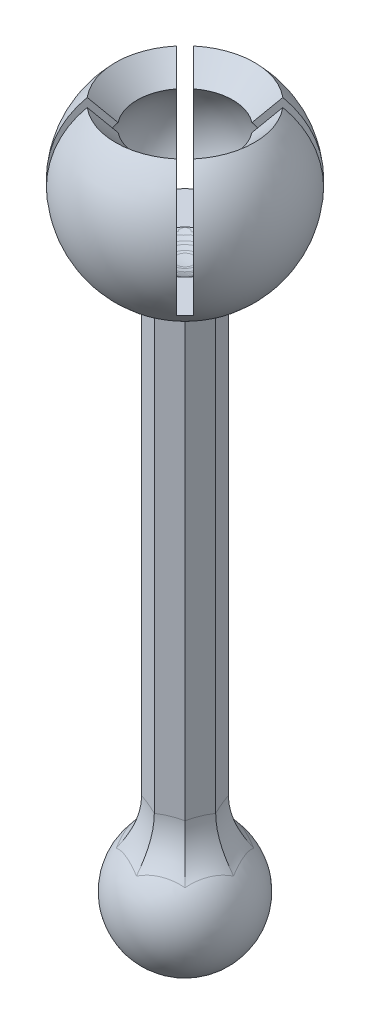
from build123d import *

# Parameters (mm, degrees)
BOSS_EXTRUDE2_DEPTH            = 25
FILLET2_R                      = 5
CUT_EXTRUDE3_REACH             = 58.152
CUT_EXTRUDE3_DIRECTION_2_DEPTH = 4.89898


with BuildPart() as part:
    # Sketch5 → Boss-Extrude2 (new, symmetric)
    with BuildSketch(Plane(origin=(0, 0, 0), x_dir=(1, 0, 0), z_dir=(0, 1, 0))):
        Polygon((2.5, 0), (1.767766953, 1.767766953), (0, 2.5), (-1.767766953, 1.767766953), (-2.5, 0), (-1.767766953, -1.767766953), (0, -2.5), (1.767766953, -1.767766953), align=None)
    extrude(amount=BOSS_EXTRUDE2_DEPTH, both=True)

    # Sketch1 → Revolve1 (revolve)
    with BuildSketch(Plane(origin=(0, -25, 0), x_dir=(1, 0, 0), z_dir=(0, 1, 0))):
        with BuildLine():
            Line((0, 5), (0, -5))
            ThreePointArc((0, -5), (-5, 0), (0, 5))
        make_face()
    revolve(axis=Axis((0, -25, -5), (0, 0, 1)))

    # Sketch4 → Cut-Revolve1 (revolve, cut)
    with BuildSketch(Plane.XY):
        with BuildLine():
            Line((0, 30.5), (0, 19.5))
            ThreePointArc((0, 19.5), (-5.5, 25), (0, 30.5))
        make_face()
    revolve(axis=Axis((0, 30.5, 0), (0, -1, 0)), mode=Mode.SUBTRACT)

    # Fillet2
    # the kernel refuses this fillet: 5 mm, written as the material it adds along each edge
    with BuildSketch(Plane(origin=(0.883883476, -25, 2.133883476), x_dir=(0.9238618205615631, 0.0061921066631474625, -0.3826760958352982), z_dir=(0.005720760609208701, -0.9999808287237671, -0.002369616631424014))) as fillet2_piece_1_section:
        with BuildLine():
            CenterArc((6.824097229, 5), FILLET2_R, 226.967764514, 43.032235486)
            Line((6.824097229, 0), (6.824097229, -0.1))
            Line((6.824097229, -0.1), (4.434556495, -0.1))
            Line((4.434556495, -0.1), (4.345865365, -0.046193977))
            ThreePointArc((4.345865365, -0.046193977), (3.900924494, 0.655564748), (3.343807642, 1.272053596))
            Line((3.343807642, 1.272053596), (3.412048615, 1.345150584))
        make_face()
    fillet2_piece_1 = revolve(axis=Axis((0.883883476, -25, 2.133883476), (0.38268343236508984, 0, 0.9238795325112867)), revolution_arc=179.290432309, mode=Mode.PRIVATE)
    fillet2_piece_1 = split(fillet2_piece_1, bisect_by=Plane(origin=(1.508883476, -25, 2.392766953), z_dir=(-0.9238795325112867, 0, -0.38268343236508995)), keep=Keep.TOP, mode=Mode.PRIVATE)
    fillet2_piece_1 = split(fillet2_piece_1, bisect_by=Plane(origin=(0.625, -25, 2.758883476), z_dir=(0.38268343236509017, 0, -0.9238795325112866)), keep=Keep.TOP, mode=Mode.PRIVATE)
    add(fillet2_piece_1)
    with BuildSketch(Plane(origin=(0.883883476, -25, 2.133883476), x_dir=(0.9238618205615631, 0.0061921066631474625, -0.3826760958352982), z_dir=(0.005720760609208701, -0.9999808287237671, -0.002369616631424014))) as fillet2_piece_2_section:
        with BuildLine():
            CenterArc((6.824097229, 5), FILLET2_R, 226.967764514, 43.032235486)
            Line((6.824097229, 0), (6.824097229, -0.1))
            Line((6.824097229, -0.1), (4.434556495, -0.1))
            Line((4.434556495, -0.1), (4.345865365, -0.046193977))
            ThreePointArc((4.345865365, -0.046193977), (3.900924494, 0.655564748), (3.343807642, 1.272053596))
            Line((3.343807642, 1.272053596), (3.412048615, 1.345150584))
        make_face()
    fillet2_piece_2 = revolve(axis=Axis((0.883883476, -25, 2.133883476), (0.38268343236508984, 0, 0.9238795325112867)), revolution_arc=179.290432309, mode=Mode.PRIVATE)
    fillet2_piece_2 = split(fillet2_piece_2, bisect_by=Plane(origin=(1.508883476, -25, 2.392766953), z_dir=(0.9238795325112867, 0, 0.38268343236508995)), keep=Keep.TOP, mode=Mode.PRIVATE)
    fillet2_piece_2 = split(fillet2_piece_2, bisect_by=Plane(origin=(0.625, -25, 2.758883476), z_dir=(-0.38268343236509017, 0, 0.9238795325112866)), keep=Keep.TOP, mode=Mode.PRIVATE)
    add(fillet2_piece_2)
    with BuildSketch(Plane(origin=(2.133883476, -25, 0.883883476), x_dir=(0.3826760958352924, 0.006192106665672666, -0.9238618205615488), z_dir=(0.002369616632390368, -0.9999808287237517, -0.0057207606115416846))) as fillet2_piece_3_section:
        with BuildLine():
            CenterArc((6.824097229, 5), FILLET2_R, 226.967764514, 43.032235486)
            Line((6.824097229, 0), (6.824097229, -0.1))
            Line((6.824097229, -0.1), (4.434556495, -0.1))
            Line((4.434556495, -0.1), (4.345865365, -0.046193977))
            ThreePointArc((4.345865365, -0.046193977), (3.900924494, 0.655564748), (3.343807642, 1.272053596))
            Line((3.343807642, 1.272053596), (3.412048615, 1.345150584))
        make_face()
    fillet2_piece_3 = revolve(axis=Axis((2.133883476, -25, 0.883883476), (0.9238795325112867, 0, 0.38268343236508995)), revolution_arc=179.290432309, mode=Mode.PRIVATE)
    fillet2_piece_3 = split(fillet2_piece_3, bisect_by=Plane(origin=(2.758883476, -25, 0.625), z_dir=(-0.9238795325112868, 0, 0.3826834323650896)), keep=Keep.TOP, mode=Mode.PRIVATE)
    fillet2_piece_3 = split(fillet2_piece_3, bisect_by=Plane(origin=(2.392766953, -25, 1.508883476), z_dir=(-0.3826834323650898, 0, -0.9238795325112866)), keep=Keep.TOP, mode=Mode.PRIVATE)
    add(fillet2_piece_3)
    with BuildSketch(Plane(origin=(2.133883476, -25, 0.883883476), x_dir=(0.3826760958352924, 0.006192106665672666, -0.9238618205615488), z_dir=(0.002369616632390368, -0.9999808287237517, -0.0057207606115416846))) as fillet2_piece_4_section:
        with BuildLine():
            CenterArc((6.824097229, 5), FILLET2_R, 226.967764514, 43.032235486)
            Line((6.824097229, 0), (6.824097229, -0.1))
            Line((6.824097229, -0.1), (4.434556495, -0.1))
            Line((4.434556495, -0.1), (4.345865365, -0.046193977))
            ThreePointArc((4.345865365, -0.046193977), (3.900924494, 0.655564748), (3.343807642, 1.272053596))
            Line((3.343807642, 1.272053596), (3.412048615, 1.345150584))
        make_face()
    fillet2_piece_4 = revolve(axis=Axis((2.133883476, -25, 0.883883476), (0.9238795325112867, 0, 0.38268343236508995)), revolution_arc=179.290432309, mode=Mode.PRIVATE)
    fillet2_piece_4 = split(fillet2_piece_4, bisect_by=Plane(origin=(2.758883476, -25, 0.625), z_dir=(0.9238795325112868, 0, -0.3826834323650896)), keep=Keep.TOP, mode=Mode.PRIVATE)
    fillet2_piece_4 = split(fillet2_piece_4, bisect_by=Plane(origin=(2.392766953, -25, 1.508883476), z_dir=(0.3826834323650898, 0, 0.9238795325112866)), keep=Keep.TOP, mode=Mode.PRIVATE)
    add(fillet2_piece_4)
    with BuildSketch(Plane(origin=(2.133883476, -25, -0.883883476), x_dir=(-0.38267609583529205, 0.006192106665675869, -0.9238618205615488), z_dir=(-0.002369616632391592, -0.9999808287237515, -0.005720760611544645))) as fillet2_piece_5_section:
        with BuildLine():
            CenterArc((6.824097229, 5), FILLET2_R, 226.967764514, 43.032235486)
            Line((3.412048615, 1.345150584), (3.343807642, 1.272053596))
            ThreePointArc((3.343807642, 1.272053596), (3.900924494, 0.655564748), (4.345865365, -0.046193977))
            Line((4.345865365, -0.046193977), (4.434556495, -0.1))
            Line((4.434556495, -0.1), (6.824097229, -0.1))
            Line((6.824097229, -0.1), (6.824097229, 0))
        make_face()
    fillet2_piece_5 = revolve(axis=Axis((2.133883476, -25, -0.883883476), (0.9238795325112868, 0, -0.3826834323650896)), revolution_arc=179.290432309, mode=Mode.PRIVATE)
    fillet2_piece_5 = split(fillet2_piece_5, bisect_by=Plane(origin=(2.392766953, -25, -1.508883476), z_dir=(0.3826834323650899, 0, -0.9238795325112867)), keep=Keep.TOP, mode=Mode.PRIVATE)
    fillet2_piece_5 = split(fillet2_piece_5, bisect_by=Plane(origin=(2.758883476, -25, -0.625), z_dir=(0.9238795325112867, 0, 0.38268343236508995)), keep=Keep.TOP, mode=Mode.PRIVATE)
    add(fillet2_piece_5)
    with BuildSketch(Plane(origin=(2.133883476, -25, -0.883883476), x_dir=(-0.38267609583529205, 0.006192106665675869, -0.9238618205615488), z_dir=(-0.002369616632391592, -0.9999808287237515, -0.005720760611544645))) as fillet2_piece_6_section:
        with BuildLine():
            CenterArc((6.824097229, 5), FILLET2_R, 226.967764514, 43.032235486)
            Line((3.412048615, 1.345150584), (3.343807642, 1.272053596))
            ThreePointArc((3.343807642, 1.272053596), (3.900924494, 0.655564748), (4.345865365, -0.046193977))
            Line((4.345865365, -0.046193977), (4.434556495, -0.1))
            Line((4.434556495, -0.1), (6.824097229, -0.1))
            Line((6.824097229, -0.1), (6.824097229, 0))
        make_face()
    fillet2_piece_6 = revolve(axis=Axis((2.133883476, -25, -0.883883476), (0.9238795325112868, 0, -0.3826834323650896)), revolution_arc=179.290432309, mode=Mode.PRIVATE)
    fillet2_piece_6 = split(fillet2_piece_6, bisect_by=Plane(origin=(2.392766953, -25, -1.508883476), z_dir=(-0.3826834323650899, 0, 0.9238795325112867)), keep=Keep.TOP, mode=Mode.PRIVATE)
    fillet2_piece_6 = split(fillet2_piece_6, bisect_by=Plane(origin=(2.758883476, -25, -0.625), z_dir=(-0.9238795325112867, 0, -0.38268343236508995)), keep=Keep.TOP, mode=Mode.PRIVATE)
    add(fillet2_piece_6)
    with BuildSketch(Plane(origin=(0.883883476, -25, -2.133883476), x_dir=(-0.9238618205615631, 0.006192106663146662, -0.3826760958352983), z_dir=(-0.005720760609207962, -0.9999808287237673, -0.002369616631423708))) as fillet2_piece_7_section:
        with BuildLine():
            CenterArc((6.824097229, 5), FILLET2_R, 226.967764514, 43.032235486)
            Line((3.412048615, 1.345150584), (3.343807642, 1.272053596))
            ThreePointArc((3.343807642, 1.272053596), (3.900924494, 0.655564748), (4.345865365, -0.046193977))
            Line((4.345865365, -0.046193977), (4.434556495, -0.1))
            Line((4.434556495, -0.1), (6.824097229, -0.1))
            Line((6.824097229, -0.1), (6.824097229, 0))
        make_face()
    fillet2_piece_7 = revolve(axis=Axis((0.883883476, -25, -2.133883476), (0.3826834323650899, 0, -0.9238795325112867)), revolution_arc=179.290432309, mode=Mode.PRIVATE)
    fillet2_piece_7 = split(fillet2_piece_7, bisect_by=Plane(origin=(1.508883476, -25, -2.392766953), z_dir=(0.9238795325112868, 0, -0.3826834323650896)), keep=Keep.TOP, mode=Mode.PRIVATE)
    fillet2_piece_7 = split(fillet2_piece_7, bisect_by=Plane(origin=(0.625, -25, -2.758883476), z_dir=(-0.3826834323650895, 0, -0.9238795325112868)), keep=Keep.TOP, mode=Mode.PRIVATE)
    add(fillet2_piece_7)
    with BuildSketch(Plane(origin=(0.883883476, -25, -2.133883476), x_dir=(-0.9238618205615631, 0.006192106663146662, -0.3826760958352983), z_dir=(-0.005720760609207962, -0.9999808287237673, -0.002369616631423708))) as fillet2_piece_8_section:
        with BuildLine():
            CenterArc((6.824097229, 5), FILLET2_R, 226.967764514, 43.032235486)
            Line((3.412048615, 1.345150584), (3.343807642, 1.272053596))
            ThreePointArc((3.343807642, 1.272053596), (3.900924494, 0.655564748), (4.345865365, -0.046193977))
            Line((4.345865365, -0.046193977), (4.434556495, -0.1))
            Line((4.434556495, -0.1), (6.824097229, -0.1))
            Line((6.824097229, -0.1), (6.824097229, 0))
        make_face()
    fillet2_piece_8 = revolve(axis=Axis((0.883883476, -25, -2.133883476), (0.3826834323650899, 0, -0.9238795325112867)), revolution_arc=179.290432309, mode=Mode.PRIVATE)
    fillet2_piece_8 = split(fillet2_piece_8, bisect_by=Plane(origin=(1.508883476, -25, -2.392766953), z_dir=(-0.9238795325112868, 0, 0.3826834323650896)), keep=Keep.TOP, mode=Mode.PRIVATE)
    fillet2_piece_8 = split(fillet2_piece_8, bisect_by=Plane(origin=(0.625, -25, -2.758883476), z_dir=(0.3826834323650895, 0, 0.9238795325112868)), keep=Keep.TOP, mode=Mode.PRIVATE)
    add(fillet2_piece_8)
    with BuildSketch(Plane(origin=(-0.883883476, -25, -2.133883476), x_dir=(-0.9238618205615633, 0.006192106663145061, 0.382676095835298), z_dir=(-0.005720760609206483, -0.9999808287237673, 0.002369616631423093))) as fillet2_piece_9_section:
        with BuildLine():
            CenterArc((6.824097229, 5), FILLET2_R, 226.967764514, 43.032235486)
            Line((6.824097229, 0), (6.824097229, -0.1))
            Line((6.824097229, -0.1), (4.434556495, -0.1))
            Line((4.434556495, -0.1), (4.345865365, -0.046193977))
            ThreePointArc((4.345865365, -0.046193977), (3.900924494, 0.655564748), (3.343807642, 1.272053596))
            Line((3.343807642, 1.272053596), (3.412048615, 1.345150584))
        make_face()
    fillet2_piece_9 = revolve(axis=Axis((-0.883883476, -25, -2.133883476), (-0.3826834323650895, 0, -0.9238795325112868)), revolution_arc=179.290432309, mode=Mode.PRIVATE)
    fillet2_piece_9 = split(fillet2_piece_9, bisect_by=Plane(origin=(-0.625, -25, -2.758883476), z_dir=(-0.3826834323650899, 0, 0.9238795325112867)), keep=Keep.TOP, mode=Mode.PRIVATE)
    fillet2_piece_9 = split(fillet2_piece_9, bisect_by=Plane(origin=(-1.508883476, -25, -2.392766953), z_dir=(0.9238795325112867, 0, 0.38268343236508995)), keep=Keep.TOP, mode=Mode.PRIVATE)
    add(fillet2_piece_9)
    with BuildSketch(Plane(origin=(-0.883883476, -25, -2.133883476), x_dir=(-0.9238618205615633, 0.006192106663145061, 0.382676095835298), z_dir=(-0.005720760609206483, -0.9999808287237673, 0.002369616631423093))) as fillet2_piece_10_section:
        with BuildLine():
            CenterArc((6.824097229, 5), FILLET2_R, 226.967764514, 43.032235486)
            Line((6.824097229, 0), (6.824097229, -0.1))
            Line((6.824097229, -0.1), (4.434556495, -0.1))
            Line((4.434556495, -0.1), (4.345865365, -0.046193977))
            ThreePointArc((4.345865365, -0.046193977), (3.900924494, 0.655564748), (3.343807642, 1.272053596))
            Line((3.343807642, 1.272053596), (3.412048615, 1.345150584))
        make_face()
    fillet2_piece_10 = revolve(axis=Axis((-0.883883476, -25, -2.133883476), (-0.3826834323650895, 0, -0.9238795325112868)), revolution_arc=179.290432309, mode=Mode.PRIVATE)
    fillet2_piece_10 = split(fillet2_piece_10, bisect_by=Plane(origin=(-0.625, -25, -2.758883476), z_dir=(0.3826834323650899, 0, -0.9238795325112867)), keep=Keep.TOP, mode=Mode.PRIVATE)
    fillet2_piece_10 = split(fillet2_piece_10, bisect_by=Plane(origin=(-1.508883476, -25, -2.392766953), z_dir=(-0.9238795325112867, 0, -0.38268343236508995)), keep=Keep.TOP, mode=Mode.PRIVATE)
    add(fillet2_piece_10)
    with BuildSketch(Plane(origin=(-2.133883476, -25, -0.883883476), x_dir=(-0.3826760958352924, 0.006192106665672666, 0.9238618205615488), z_dir=(-0.002369616632390368, -0.9999808287237517, 0.0057207606115416846))) as fillet2_piece_11_section:
        with BuildLine():
            CenterArc((6.824097229, 5), FILLET2_R, 226.967764514, 43.032235486)
            Line((6.824097229, 0), (6.824097229, -0.1))
            Line((6.824097229, -0.1), (4.434556495, -0.1))
            Line((4.434556495, -0.1), (4.345865365, -0.046193977))
            ThreePointArc((4.345865365, -0.046193977), (3.900924494, 0.655564748), (3.343807642, 1.272053596))
            Line((3.343807642, 1.272053596), (3.412048615, 1.345150584))
        make_face()
    fillet2_piece_11 = revolve(axis=Axis((-2.133883476, -25, -0.883883476), (-0.9238795325112867, 0, -0.38268343236508995)), revolution_arc=179.290432309, mode=Mode.PRIVATE)
    fillet2_piece_11 = split(fillet2_piece_11, bisect_by=Plane(origin=(-2.392766953, -25, -1.508883476), z_dir=(0.3826834323650895, 0, 0.9238795325112868)), keep=Keep.TOP, mode=Mode.PRIVATE)
    fillet2_piece_11 = split(fillet2_piece_11, bisect_by=Plane(origin=(-2.758883476, -25, -0.625), z_dir=(0.9238795325112867, 0, -0.3826834323650897)), keep=Keep.TOP, mode=Mode.PRIVATE)
    add(fillet2_piece_11)
    with BuildSketch(Plane(origin=(-2.133883476, -25, -0.883883476), x_dir=(-0.3826760958352924, 0.006192106665672666, 0.9238618205615488), z_dir=(-0.002369616632390368, -0.9999808287237517, 0.0057207606115416846))) as fillet2_piece_12_section:
        with BuildLine():
            CenterArc((6.824097229, 5), FILLET2_R, 226.967764514, 43.032235486)
            Line((6.824097229, 0), (6.824097229, -0.1))
            Line((6.824097229, -0.1), (4.434556495, -0.1))
            Line((4.434556495, -0.1), (4.345865365, -0.046193977))
            ThreePointArc((4.345865365, -0.046193977), (3.900924494, 0.655564748), (3.343807642, 1.272053596))
            Line((3.343807642, 1.272053596), (3.412048615, 1.345150584))
        make_face()
    fillet2_piece_12 = revolve(axis=Axis((-2.133883476, -25, -0.883883476), (-0.9238795325112867, 0, -0.38268343236508995)), revolution_arc=179.290432309, mode=Mode.PRIVATE)
    fillet2_piece_12 = split(fillet2_piece_12, bisect_by=Plane(origin=(-2.392766953, -25, -1.508883476), z_dir=(-0.3826834323650895, 0, -0.9238795325112868)), keep=Keep.TOP, mode=Mode.PRIVATE)
    fillet2_piece_12 = split(fillet2_piece_12, bisect_by=Plane(origin=(-2.758883476, -25, -0.625), z_dir=(-0.9238795325112867, 0, 0.3826834323650897)), keep=Keep.TOP, mode=Mode.PRIVATE)
    add(fillet2_piece_12)
    with BuildSketch(Plane(origin=(-2.133883476, -25, 0.883883476), x_dir=(0.38267609583529216, 0.006192106665672666, 0.9238618205615488), z_dir=(0.002369616632390367, -0.9999808287237516, 0.0057207606115416846))) as fillet2_piece_13_section:
        with BuildLine():
            CenterArc((6.824097229, 5), FILLET2_R, 226.967764514, 43.032235486)
            Line((6.824097229, 0), (6.824097229, -0.1))
            Line((6.824097229, -0.1), (4.434556495, -0.1))
            Line((4.434556495, -0.1), (4.345865365, -0.046193977))
            ThreePointArc((4.345865365, -0.046193977), (3.900924494, 0.655564748), (3.343807642, 1.272053596))
            Line((3.343807642, 1.272053596), (3.412048615, 1.345150584))
        make_face()
    fillet2_piece_13 = revolve(axis=Axis((-2.133883476, -25, 0.883883476), (-0.9238795325112867, 0, 0.3826834323650897)), revolution_arc=179.290432309, mode=Mode.PRIVATE)
    fillet2_piece_13 = split(fillet2_piece_13, bisect_by=Plane(origin=(-2.758883476, -25, 0.625), z_dir=(0.9238795325112867, 0, 0.38268343236508995)), keep=Keep.TOP, mode=Mode.PRIVATE)
    fillet2_piece_13 = split(fillet2_piece_13, bisect_by=Plane(origin=(-2.392766953, -25, 1.508883476), z_dir=(0.38268343236509017, 0, -0.9238795325112866)), keep=Keep.TOP, mode=Mode.PRIVATE)
    add(fillet2_piece_13)
    with BuildSketch(Plane(origin=(-2.133883476, -25, 0.883883476), x_dir=(0.38267609583529216, 0.006192106665672666, 0.9238618205615488), z_dir=(0.002369616632390367, -0.9999808287237516, 0.0057207606115416846))) as fillet2_piece_14_section:
        with BuildLine():
            CenterArc((6.824097229, 5), FILLET2_R, 226.967764514, 43.032235486)
            Line((6.824097229, 0), (6.824097229, -0.1))
            Line((6.824097229, -0.1), (4.434556495, -0.1))
            Line((4.434556495, -0.1), (4.345865365, -0.046193977))
            ThreePointArc((4.345865365, -0.046193977), (3.900924494, 0.655564748), (3.343807642, 1.272053596))
            Line((3.343807642, 1.272053596), (3.412048615, 1.345150584))
        make_face()
    fillet2_piece_14 = revolve(axis=Axis((-2.133883476, -25, 0.883883476), (-0.9238795325112867, 0, 0.3826834323650897)), revolution_arc=179.290432309, mode=Mode.PRIVATE)
    fillet2_piece_14 = split(fillet2_piece_14, bisect_by=Plane(origin=(-2.758883476, -25, 0.625), z_dir=(-0.9238795325112867, 0, -0.38268343236508995)), keep=Keep.TOP, mode=Mode.PRIVATE)
    fillet2_piece_14 = split(fillet2_piece_14, bisect_by=Plane(origin=(-2.392766953, -25, 1.508883476), z_dir=(-0.38268343236509017, 0, 0.9238795325112866)), keep=Keep.TOP, mode=Mode.PRIVATE)
    add(fillet2_piece_14)
    with BuildSketch(Plane(origin=(-0.883883476, -25, 2.133883476), x_dir=(0.923861820561563, 0.006192106663149065, 0.3826760958352986), z_dir=(0.0057207606092101815, -0.9999808287237673, 0.0023696166314246293))) as fillet2_piece_15_section:
        with BuildLine():
            CenterArc((6.824097229, 5), FILLET2_R, 226.967764514, 43.032235486)
            Line((6.824097229, 0), (6.824097229, -0.1))
            Line((6.824097229, -0.1), (4.434556495, -0.1))
            Line((4.434556495, -0.1), (4.345865365, -0.046193977))
            ThreePointArc((4.345865365, -0.046193977), (3.900924494, 0.655564748), (3.343807642, 1.272053596))
            Line((3.343807642, 1.272053596), (3.412048615, 1.345150584))
        make_face()
    fillet2_piece_15 = revolve(axis=Axis((-0.883883476, -25, 2.133883476), (-0.38268343236509017, 0, 0.9238795325112866)), revolution_arc=179.290432309, mode=Mode.PRIVATE)
    fillet2_piece_15 = split(fillet2_piece_15, bisect_by=Plane(origin=(-0.625, -25, 2.758883476), z_dir=(-0.3826834323650898, 0, -0.9238795325112866)), keep=Keep.TOP, mode=Mode.PRIVATE)
    fillet2_piece_15 = split(fillet2_piece_15, bisect_by=Plane(origin=(-1.508883476, -25, 2.392766953), z_dir=(0.9238795325112867, 0, -0.3826834323650897)), keep=Keep.TOP, mode=Mode.PRIVATE)
    add(fillet2_piece_15)
    with BuildSketch(Plane(origin=(-0.883883476, -25, 2.133883476), x_dir=(0.923861820561563, 0.006192106663149065, 0.3826760958352986), z_dir=(0.0057207606092101815, -0.9999808287237673, 0.0023696166314246293))) as fillet2_piece_16_section:
        with BuildLine():
            CenterArc((6.824097229, 5), FILLET2_R, 226.967764514, 43.032235486)
            Line((6.824097229, 0), (6.824097229, -0.1))
            Line((6.824097229, -0.1), (4.434556495, -0.1))
            Line((4.434556495, -0.1), (4.345865365, -0.046193977))
            ThreePointArc((4.345865365, -0.046193977), (3.900924494, 0.655564748), (3.343807642, 1.272053596))
            Line((3.343807642, 1.272053596), (3.412048615, 1.345150584))
        make_face()
    fillet2_piece_16 = revolve(axis=Axis((-0.883883476, -25, 2.133883476), (-0.38268343236509017, 0, 0.9238795325112866)), revolution_arc=179.290432309, mode=Mode.PRIVATE)
    fillet2_piece_16 = split(fillet2_piece_16, bisect_by=Plane(origin=(-0.625, -25, 2.758883476), z_dir=(0.3826834323650898, 0, 0.9238795325112866)), keep=Keep.TOP, mode=Mode.PRIVATE)
    fillet2_piece_16 = split(fillet2_piece_16, bisect_by=Plane(origin=(-1.508883476, -25, 2.392766953), z_dir=(-0.9238795325112867, 0, 0.3826834323650897)), keep=Keep.TOP, mode=Mode.PRIVATE)
    add(fillet2_piece_16)
    with BuildSketch(Plane(origin=(2.133883476, -25, 0.883883476), x_dir=(0.3826760958352924, 0.006192106665672666, -0.9238618205615488), z_dir=(0.002369616632390368, -0.9999808287237517, -0.0057207606115416846))) as fillet2_piece_17a_section:
        with BuildLine():
            CenterArc((6.824097229, 5), FILLET2_R, 226.967764514, 43.032235486)
            Line((6.824097229, 0), (6.824097229, -0.1))
            Line((6.824097229, -0.1), (4.434556495, -0.1))
            Line((4.434556495, -0.1), (4.345865365, -0.046193977))
            ThreePointArc((4.345865365, -0.046193977), (3.900924494, 0.655564748), (3.343807642, 1.272053596))
            Line((3.343807642, 1.272053596), (3.412048615, 1.345150584))
        make_face()
    fillet2_piece_17a = revolve(axis=Axis((2.133883476, -25, 0.883883476), (0.9238795325112867, 0, 0.38268343236508995)), revolution_arc=179.290432309, mode=Mode.PRIVATE)
    fillet2_piece_17a = split(fillet2_piece_17a, bisect_by=Plane(origin=(2.758883476, -25, 0.625), z_dir=(-0.9238795325112868, 0, 0.3826834323650896)), keep=Keep.TOP, mode=Mode.PRIVATE)
    fillet2_piece_17a = split(fillet2_piece_17a, bisect_by=Plane(origin=(2.392766953, -25, 1.508883476), z_dir=(0.3826834323650898, 0, 0.9238795325112866)), keep=Keep.TOP, mode=Mode.PRIVATE)
    with BuildSketch(Plane(origin=(0.883883476, -25, 2.133883476), x_dir=(0.9238618205615631, 0.0061921066631474625, -0.3826760958352982), z_dir=(0.005720760609208701, -0.9999808287237671, -0.002369616631424014))) as fillet2_piece_17b_section:
        with BuildLine():
            CenterArc((6.824097229, 5), FILLET2_R, 226.967764514, 43.032235486)
            Line((6.824097229, 0), (6.824097229, -0.1))
            Line((6.824097229, -0.1), (4.434556495, -0.1))
            Line((4.434556495, -0.1), (4.345865365, -0.046193977))
            ThreePointArc((4.345865365, -0.046193977), (3.900924494, 0.655564748), (3.343807642, 1.272053596))
            Line((3.343807642, 1.272053596), (3.412048615, 1.345150584))
        make_face()
    fillet2_piece_17b = revolve(axis=Axis((0.883883476, -25, 2.133883476), (0.38268343236508984, 0, 0.9238795325112867)), revolution_arc=179.290432309, mode=Mode.PRIVATE)
    fillet2_piece_17b = split(fillet2_piece_17b, bisect_by=Plane(origin=(1.508883476, -25, 2.392766953), z_dir=(0.9238795325112867, 0, 0.38268343236508995)), keep=Keep.TOP, mode=Mode.PRIVATE)
    fillet2_piece_17b = split(fillet2_piece_17b, bisect_by=Plane(origin=(0.625, -25, 2.758883476), z_dir=(0.38268343236509017, 0, -0.9238795325112866)), keep=Keep.TOP, mode=Mode.PRIVATE)
    fillet2_piece_17 = fillet2_piece_17a & fillet2_piece_17b
    add(fillet2_piece_17)
    with BuildSketch(Plane(origin=(0.883883476, -25, 2.133883476), x_dir=(0.9238618205615631, 0.0061921066631474625, -0.3826760958352982), z_dir=(0.005720760609208701, -0.9999808287237671, -0.002369616631424014))) as fillet2_piece_18a_section:
        with BuildLine():
            CenterArc((6.824097229, 5), FILLET2_R, 226.967764514, 43.032235486)
            Line((6.824097229, 0), (6.824097229, -0.1))
            Line((6.824097229, -0.1), (4.434556495, -0.1))
            Line((4.434556495, -0.1), (4.345865365, -0.046193977))
            ThreePointArc((4.345865365, -0.046193977), (3.900924494, 0.655564748), (3.343807642, 1.272053596))
            Line((3.343807642, 1.272053596), (3.412048615, 1.345150584))
        make_face()
    fillet2_piece_18a = revolve(axis=Axis((0.883883476, -25, 2.133883476), (0.38268343236508984, 0, 0.9238795325112867)), revolution_arc=179.290432309, mode=Mode.PRIVATE)
    fillet2_piece_18a = split(fillet2_piece_18a, bisect_by=Plane(origin=(1.508883476, -25, 2.392766953), z_dir=(-0.9238795325112867, 0, -0.38268343236508995)), keep=Keep.TOP, mode=Mode.PRIVATE)
    fillet2_piece_18a = split(fillet2_piece_18a, bisect_by=Plane(origin=(0.625, -25, 2.758883476), z_dir=(-0.38268343236509017, 0, 0.9238795325112866)), keep=Keep.TOP, mode=Mode.PRIVATE)
    with BuildSketch(Plane(origin=(-0.883883476, -25, 2.133883476), x_dir=(0.923861820561563, 0.006192106663149065, 0.3826760958352986), z_dir=(0.0057207606092101815, -0.9999808287237673, 0.0023696166314246293))) as fillet2_piece_18b_section:
        with BuildLine():
            CenterArc((6.824097229, 5), FILLET2_R, 226.967764514, 43.032235486)
            Line((6.824097229, 0), (6.824097229, -0.1))
            Line((6.824097229, -0.1), (4.434556495, -0.1))
            Line((4.434556495, -0.1), (4.345865365, -0.046193977))
            ThreePointArc((4.345865365, -0.046193977), (3.900924494, 0.655564748), (3.343807642, 1.272053596))
            Line((3.343807642, 1.272053596), (3.412048615, 1.345150584))
        make_face()
    fillet2_piece_18b = revolve(axis=Axis((-0.883883476, -25, 2.133883476), (-0.38268343236509017, 0, 0.9238795325112866)), revolution_arc=179.290432309, mode=Mode.PRIVATE)
    fillet2_piece_18b = split(fillet2_piece_18b, bisect_by=Plane(origin=(-0.625, -25, 2.758883476), z_dir=(0.3826834323650898, 0, 0.9238795325112866)), keep=Keep.TOP, mode=Mode.PRIVATE)
    fillet2_piece_18b = split(fillet2_piece_18b, bisect_by=Plane(origin=(-1.508883476, -25, 2.392766953), z_dir=(0.9238795325112867, 0, -0.3826834323650897)), keep=Keep.TOP, mode=Mode.PRIVATE)
    fillet2_piece_18 = fillet2_piece_18a & fillet2_piece_18b
    add(fillet2_piece_18)
    with BuildSketch(Plane(origin=(2.133883476, -25, -0.883883476), x_dir=(-0.38267609583529205, 0.006192106665675869, -0.9238618205615488), z_dir=(-0.002369616632391592, -0.9999808287237515, -0.005720760611544645))) as fillet2_piece_19a_section:
        with BuildLine():
            CenterArc((6.824097229, 5), FILLET2_R, 226.967764514, 43.032235486)
            Line((3.412048615, 1.345150584), (3.343807642, 1.272053596))
            ThreePointArc((3.343807642, 1.272053596), (3.900924494, 0.655564748), (4.345865365, -0.046193977))
            Line((4.345865365, -0.046193977), (4.434556495, -0.1))
            Line((4.434556495, -0.1), (6.824097229, -0.1))
            Line((6.824097229, -0.1), (6.824097229, 0))
        make_face()
    fillet2_piece_19a = revolve(axis=Axis((2.133883476, -25, -0.883883476), (0.9238795325112868, 0, -0.3826834323650896)), revolution_arc=179.290432309, mode=Mode.PRIVATE)
    fillet2_piece_19a = split(fillet2_piece_19a, bisect_by=Plane(origin=(2.392766953, -25, -1.508883476), z_dir=(-0.3826834323650899, 0, 0.9238795325112867)), keep=Keep.TOP, mode=Mode.PRIVATE)
    fillet2_piece_19a = split(fillet2_piece_19a, bisect_by=Plane(origin=(2.758883476, -25, -0.625), z_dir=(0.9238795325112867, 0, 0.38268343236508995)), keep=Keep.TOP, mode=Mode.PRIVATE)
    with BuildSketch(Plane(origin=(2.133883476, -25, 0.883883476), x_dir=(0.3826760958352924, 0.006192106665672666, -0.9238618205615488), z_dir=(0.002369616632390368, -0.9999808287237517, -0.0057207606115416846))) as fillet2_piece_19b_section:
        with BuildLine():
            CenterArc((6.824097229, 5), FILLET2_R, 226.967764514, 43.032235486)
            Line((6.824097229, 0), (6.824097229, -0.1))
            Line((6.824097229, -0.1), (4.434556495, -0.1))
            Line((4.434556495, -0.1), (4.345865365, -0.046193977))
            ThreePointArc((4.345865365, -0.046193977), (3.900924494, 0.655564748), (3.343807642, 1.272053596))
            Line((3.343807642, 1.272053596), (3.412048615, 1.345150584))
        make_face()
    fillet2_piece_19b = revolve(axis=Axis((2.133883476, -25, 0.883883476), (0.9238795325112867, 0, 0.38268343236508995)), revolution_arc=179.290432309, mode=Mode.PRIVATE)
    fillet2_piece_19b = split(fillet2_piece_19b, bisect_by=Plane(origin=(2.758883476, -25, 0.625), z_dir=(0.9238795325112868, 0, -0.3826834323650896)), keep=Keep.TOP, mode=Mode.PRIVATE)
    fillet2_piece_19b = split(fillet2_piece_19b, bisect_by=Plane(origin=(2.392766953, -25, 1.508883476), z_dir=(-0.3826834323650898, 0, -0.9238795325112866)), keep=Keep.TOP, mode=Mode.PRIVATE)
    fillet2_piece_19 = fillet2_piece_19a & fillet2_piece_19b
    add(fillet2_piece_19)
    with BuildSketch(Plane(origin=(2.133883476, -25, -0.883883476), x_dir=(-0.38267609583529205, 0.006192106665675869, -0.9238618205615488), z_dir=(-0.002369616632391592, -0.9999808287237515, -0.005720760611544645))) as fillet2_piece_20a_section:
        with BuildLine():
            CenterArc((6.824097229, 5), FILLET2_R, 226.967764514, 43.032235486)
            Line((3.412048615, 1.345150584), (3.343807642, 1.272053596))
            ThreePointArc((3.343807642, 1.272053596), (3.900924494, 0.655564748), (4.345865365, -0.046193977))
            Line((4.345865365, -0.046193977), (4.434556495, -0.1))
            Line((4.434556495, -0.1), (6.824097229, -0.1))
            Line((6.824097229, -0.1), (6.824097229, 0))
        make_face()
    fillet2_piece_20a = revolve(axis=Axis((2.133883476, -25, -0.883883476), (0.9238795325112868, 0, -0.3826834323650896)), revolution_arc=179.290432309, mode=Mode.PRIVATE)
    fillet2_piece_20a = split(fillet2_piece_20a, bisect_by=Plane(origin=(2.392766953, -25, -1.508883476), z_dir=(0.3826834323650899, 0, -0.9238795325112867)), keep=Keep.TOP, mode=Mode.PRIVATE)
    fillet2_piece_20a = split(fillet2_piece_20a, bisect_by=Plane(origin=(2.758883476, -25, -0.625), z_dir=(-0.9238795325112867, 0, -0.38268343236508995)), keep=Keep.TOP, mode=Mode.PRIVATE)
    with BuildSketch(Plane(origin=(0.883883476, -25, -2.133883476), x_dir=(-0.9238618205615631, 0.006192106663146662, -0.3826760958352983), z_dir=(-0.005720760609207962, -0.9999808287237673, -0.002369616631423708))) as fillet2_piece_20b_section:
        with BuildLine():
            CenterArc((6.824097229, 5), FILLET2_R, 226.967764514, 43.032235486)
            Line((3.412048615, 1.345150584), (3.343807642, 1.272053596))
            ThreePointArc((3.343807642, 1.272053596), (3.900924494, 0.655564748), (4.345865365, -0.046193977))
            Line((4.345865365, -0.046193977), (4.434556495, -0.1))
            Line((4.434556495, -0.1), (6.824097229, -0.1))
            Line((6.824097229, -0.1), (6.824097229, 0))
        make_face()
    fillet2_piece_20b = revolve(axis=Axis((0.883883476, -25, -2.133883476), (0.3826834323650899, 0, -0.9238795325112867)), revolution_arc=179.290432309, mode=Mode.PRIVATE)
    fillet2_piece_20b = split(fillet2_piece_20b, bisect_by=Plane(origin=(1.508883476, -25, -2.392766953), z_dir=(0.9238795325112868, 0, -0.3826834323650896)), keep=Keep.TOP, mode=Mode.PRIVATE)
    fillet2_piece_20b = split(fillet2_piece_20b, bisect_by=Plane(origin=(0.625, -25, -2.758883476), z_dir=(0.3826834323650895, 0, 0.9238795325112868)), keep=Keep.TOP, mode=Mode.PRIVATE)
    fillet2_piece_20 = fillet2_piece_20a & fillet2_piece_20b
    add(fillet2_piece_20)
    with BuildSketch(Plane(origin=(0.883883476, -25, -2.133883476), x_dir=(-0.9238618205615631, 0.006192106663146662, -0.3826760958352983), z_dir=(-0.005720760609207962, -0.9999808287237673, -0.002369616631423708))) as fillet2_piece_21a_section:
        with BuildLine():
            CenterArc((6.824097229, 5), FILLET2_R, 226.967764514, 43.032235486)
            Line((3.412048615, 1.345150584), (3.343807642, 1.272053596))
            ThreePointArc((3.343807642, 1.272053596), (3.900924494, 0.655564748), (4.345865365, -0.046193977))
            Line((4.345865365, -0.046193977), (4.434556495, -0.1))
            Line((4.434556495, -0.1), (6.824097229, -0.1))
            Line((6.824097229, -0.1), (6.824097229, 0))
        make_face()
    fillet2_piece_21a = revolve(axis=Axis((0.883883476, -25, -2.133883476), (0.3826834323650899, 0, -0.9238795325112867)), revolution_arc=179.290432309, mode=Mode.PRIVATE)
    fillet2_piece_21a = split(fillet2_piece_21a, bisect_by=Plane(origin=(1.508883476, -25, -2.392766953), z_dir=(-0.9238795325112868, 0, 0.3826834323650896)), keep=Keep.TOP, mode=Mode.PRIVATE)
    fillet2_piece_21a = split(fillet2_piece_21a, bisect_by=Plane(origin=(0.625, -25, -2.758883476), z_dir=(-0.3826834323650895, 0, -0.9238795325112868)), keep=Keep.TOP, mode=Mode.PRIVATE)
    with BuildSketch(Plane(origin=(-0.883883476, -25, -2.133883476), x_dir=(-0.9238618205615633, 0.006192106663145061, 0.382676095835298), z_dir=(-0.005720760609206483, -0.9999808287237673, 0.002369616631423093))) as fillet2_piece_21b_section:
        with BuildLine():
            CenterArc((6.824097229, 5), FILLET2_R, 226.967764514, 43.032235486)
            Line((6.824097229, 0), (6.824097229, -0.1))
            Line((6.824097229, -0.1), (4.434556495, -0.1))
            Line((4.434556495, -0.1), (4.345865365, -0.046193977))
            ThreePointArc((4.345865365, -0.046193977), (3.900924494, 0.655564748), (3.343807642, 1.272053596))
            Line((3.343807642, 1.272053596), (3.412048615, 1.345150584))
        make_face()
    fillet2_piece_21b = revolve(axis=Axis((-0.883883476, -25, -2.133883476), (-0.3826834323650895, 0, -0.9238795325112868)), revolution_arc=179.290432309, mode=Mode.PRIVATE)
    fillet2_piece_21b = split(fillet2_piece_21b, bisect_by=Plane(origin=(-0.625, -25, -2.758883476), z_dir=(0.3826834323650899, 0, -0.9238795325112867)), keep=Keep.TOP, mode=Mode.PRIVATE)
    fillet2_piece_21b = split(fillet2_piece_21b, bisect_by=Plane(origin=(-1.508883476, -25, -2.392766953), z_dir=(0.9238795325112867, 0, 0.38268343236508995)), keep=Keep.TOP, mode=Mode.PRIVATE)
    fillet2_piece_21 = fillet2_piece_21a & fillet2_piece_21b
    add(fillet2_piece_21)
    with BuildSketch(Plane(origin=(-2.133883476, -25, -0.883883476), x_dir=(-0.3826760958352924, 0.006192106665672666, 0.9238618205615488), z_dir=(-0.002369616632390368, -0.9999808287237517, 0.0057207606115416846))) as fillet2_piece_22a_section:
        with BuildLine():
            CenterArc((6.824097229, 5), FILLET2_R, 226.967764514, 43.032235486)
            Line((6.824097229, 0), (6.824097229, -0.1))
            Line((6.824097229, -0.1), (4.434556495, -0.1))
            Line((4.434556495, -0.1), (4.345865365, -0.046193977))
            ThreePointArc((4.345865365, -0.046193977), (3.900924494, 0.655564748), (3.343807642, 1.272053596))
            Line((3.343807642, 1.272053596), (3.412048615, 1.345150584))
        make_face()
    fillet2_piece_22a = revolve(axis=Axis((-2.133883476, -25, -0.883883476), (-0.9238795325112867, 0, -0.38268343236508995)), revolution_arc=179.290432309, mode=Mode.PRIVATE)
    fillet2_piece_22a = split(fillet2_piece_22a, bisect_by=Plane(origin=(-2.392766953, -25, -1.508883476), z_dir=(-0.3826834323650895, 0, -0.9238795325112868)), keep=Keep.TOP, mode=Mode.PRIVATE)
    fillet2_piece_22a = split(fillet2_piece_22a, bisect_by=Plane(origin=(-2.758883476, -25, -0.625), z_dir=(0.9238795325112867, 0, -0.3826834323650897)), keep=Keep.TOP, mode=Mode.PRIVATE)
    with BuildSketch(Plane(origin=(-0.883883476, -25, -2.133883476), x_dir=(-0.9238618205615633, 0.006192106663145061, 0.382676095835298), z_dir=(-0.005720760609206483, -0.9999808287237673, 0.002369616631423093))) as fillet2_piece_22b_section:
        with BuildLine():
            CenterArc((6.824097229, 5), FILLET2_R, 226.967764514, 43.032235486)
            Line((6.824097229, 0), (6.824097229, -0.1))
            Line((6.824097229, -0.1), (4.434556495, -0.1))
            Line((4.434556495, -0.1), (4.345865365, -0.046193977))
            ThreePointArc((4.345865365, -0.046193977), (3.900924494, 0.655564748), (3.343807642, 1.272053596))
            Line((3.343807642, 1.272053596), (3.412048615, 1.345150584))
        make_face()
    fillet2_piece_22b = revolve(axis=Axis((-0.883883476, -25, -2.133883476), (-0.3826834323650895, 0, -0.9238795325112868)), revolution_arc=179.290432309, mode=Mode.PRIVATE)
    fillet2_piece_22b = split(fillet2_piece_22b, bisect_by=Plane(origin=(-0.625, -25, -2.758883476), z_dir=(-0.3826834323650899, 0, 0.9238795325112867)), keep=Keep.TOP, mode=Mode.PRIVATE)
    fillet2_piece_22b = split(fillet2_piece_22b, bisect_by=Plane(origin=(-1.508883476, -25, -2.392766953), z_dir=(-0.9238795325112867, 0, -0.38268343236508995)), keep=Keep.TOP, mode=Mode.PRIVATE)
    fillet2_piece_22 = fillet2_piece_22a & fillet2_piece_22b
    add(fillet2_piece_22)
    with BuildSketch(Plane(origin=(-2.133883476, -25, 0.883883476), x_dir=(0.38267609583529216, 0.006192106665672666, 0.9238618205615488), z_dir=(0.002369616632390367, -0.9999808287237516, 0.0057207606115416846))) as fillet2_piece_23a_section:
        with BuildLine():
            CenterArc((6.824097229, 5), FILLET2_R, 226.967764514, 43.032235486)
            Line((6.824097229, 0), (6.824097229, -0.1))
            Line((6.824097229, -0.1), (4.434556495, -0.1))
            Line((4.434556495, -0.1), (4.345865365, -0.046193977))
            ThreePointArc((4.345865365, -0.046193977), (3.900924494, 0.655564748), (3.343807642, 1.272053596))
            Line((3.343807642, 1.272053596), (3.412048615, 1.345150584))
        make_face()
    fillet2_piece_23a = revolve(axis=Axis((-2.133883476, -25, 0.883883476), (-0.9238795325112867, 0, 0.3826834323650897)), revolution_arc=179.290432309, mode=Mode.PRIVATE)
    fillet2_piece_23a = split(fillet2_piece_23a, bisect_by=Plane(origin=(-2.758883476, -25, 0.625), z_dir=(-0.9238795325112867, 0, -0.38268343236508995)), keep=Keep.TOP, mode=Mode.PRIVATE)
    fillet2_piece_23a = split(fillet2_piece_23a, bisect_by=Plane(origin=(-2.392766953, -25, 1.508883476), z_dir=(0.38268343236509017, 0, -0.9238795325112866)), keep=Keep.TOP, mode=Mode.PRIVATE)
    with BuildSketch(Plane(origin=(-2.133883476, -25, -0.883883476), x_dir=(-0.3826760958352924, 0.006192106665672666, 0.9238618205615488), z_dir=(-0.002369616632390368, -0.9999808287237517, 0.0057207606115416846))) as fillet2_piece_23b_section:
        with BuildLine():
            CenterArc((6.824097229, 5), FILLET2_R, 226.967764514, 43.032235486)
            Line((6.824097229, 0), (6.824097229, -0.1))
            Line((6.824097229, -0.1), (4.434556495, -0.1))
            Line((4.434556495, -0.1), (4.345865365, -0.046193977))
            ThreePointArc((4.345865365, -0.046193977), (3.900924494, 0.655564748), (3.343807642, 1.272053596))
            Line((3.343807642, 1.272053596), (3.412048615, 1.345150584))
        make_face()
    fillet2_piece_23b = revolve(axis=Axis((-2.133883476, -25, -0.883883476), (-0.9238795325112867, 0, -0.38268343236508995)), revolution_arc=179.290432309, mode=Mode.PRIVATE)
    fillet2_piece_23b = split(fillet2_piece_23b, bisect_by=Plane(origin=(-2.392766953, -25, -1.508883476), z_dir=(0.3826834323650895, 0, 0.9238795325112868)), keep=Keep.TOP, mode=Mode.PRIVATE)
    fillet2_piece_23b = split(fillet2_piece_23b, bisect_by=Plane(origin=(-2.758883476, -25, -0.625), z_dir=(-0.9238795325112867, 0, 0.3826834323650897)), keep=Keep.TOP, mode=Mode.PRIVATE)
    fillet2_piece_23 = fillet2_piece_23a & fillet2_piece_23b
    add(fillet2_piece_23)
    with BuildSketch(Plane(origin=(-0.883883476, -25, 2.133883476), x_dir=(0.923861820561563, 0.006192106663149065, 0.3826760958352986), z_dir=(0.0057207606092101815, -0.9999808287237673, 0.0023696166314246293))) as fillet2_piece_24a_section:
        with BuildLine():
            CenterArc((6.824097229, 5), FILLET2_R, 226.967764514, 43.032235486)
            Line((6.824097229, 0), (6.824097229, -0.1))
            Line((6.824097229, -0.1), (4.434556495, -0.1))
            Line((4.434556495, -0.1), (4.345865365, -0.046193977))
            ThreePointArc((4.345865365, -0.046193977), (3.900924494, 0.655564748), (3.343807642, 1.272053596))
            Line((3.343807642, 1.272053596), (3.412048615, 1.345150584))
        make_face()
    fillet2_piece_24a = revolve(axis=Axis((-0.883883476, -25, 2.133883476), (-0.38268343236509017, 0, 0.9238795325112866)), revolution_arc=179.290432309, mode=Mode.PRIVATE)
    fillet2_piece_24a = split(fillet2_piece_24a, bisect_by=Plane(origin=(-0.625, -25, 2.758883476), z_dir=(-0.3826834323650898, 0, -0.9238795325112866)), keep=Keep.TOP, mode=Mode.PRIVATE)
    fillet2_piece_24a = split(fillet2_piece_24a, bisect_by=Plane(origin=(-1.508883476, -25, 2.392766953), z_dir=(-0.9238795325112867, 0, 0.3826834323650897)), keep=Keep.TOP, mode=Mode.PRIVATE)
    with BuildSketch(Plane(origin=(-2.133883476, -25, 0.883883476), x_dir=(0.38267609583529216, 0.006192106665672666, 0.9238618205615488), z_dir=(0.002369616632390367, -0.9999808287237516, 0.0057207606115416846))) as fillet2_piece_24b_section:
        with BuildLine():
            CenterArc((6.824097229, 5), FILLET2_R, 226.967764514, 43.032235486)
            Line((6.824097229, 0), (6.824097229, -0.1))
            Line((6.824097229, -0.1), (4.434556495, -0.1))
            Line((4.434556495, -0.1), (4.345865365, -0.046193977))
            ThreePointArc((4.345865365, -0.046193977), (3.900924494, 0.655564748), (3.343807642, 1.272053596))
            Line((3.343807642, 1.272053596), (3.412048615, 1.345150584))
        make_face()
    fillet2_piece_24b = revolve(axis=Axis((-2.133883476, -25, 0.883883476), (-0.9238795325112867, 0, 0.3826834323650897)), revolution_arc=179.290432309, mode=Mode.PRIVATE)
    fillet2_piece_24b = split(fillet2_piece_24b, bisect_by=Plane(origin=(-2.758883476, -25, 0.625), z_dir=(0.9238795325112867, 0, 0.38268343236508995)), keep=Keep.TOP, mode=Mode.PRIVATE)
    fillet2_piece_24b = split(fillet2_piece_24b, bisect_by=Plane(origin=(-2.392766953, -25, 1.508883476), z_dir=(-0.38268343236509017, 0, 0.9238795325112866)), keep=Keep.TOP, mode=Mode.PRIVATE)
    fillet2_piece_24 = fillet2_piece_24a & fillet2_piece_24b
    add(fillet2_piece_24)


with BuildPart() as body_2:
    # Sketch3 → Revolve2 (revolve)
    with BuildSketch(Plane.XY):
        with BuildLine():
            Line((-5.656854249, 30.656854249), (-3.889087297, 28.889087297))
            ThreePointArc((-3.889087297, 28.889087297), (-5.081337429, 22.895241122), (0, 19.5))
            Line((0, 19.5), (0, 17))
            ThreePointArc((0, 17), (-7.39103626, 21.938532541), (-5.656854249, 30.656854249))
        make_face()
    revolve(axis=Axis((0, 19.5, 0), (0, -1, 0)))

    # Cut-Extrude3: up to this cone (the profile starts outside it)
    cut_extrude3_end = Plane(origin=(0, 25, 0), z_dir=(0, 1, 0)).offset(1e-06) * Cone(1e-06, 58.652, 58.651999, align=(Align.CENTER, Align.CENTER, Align.MIN), mode=Mode.PRIVATE)
    # Sketch6 → Cut-Extrude3 (cut, up to the surface)
    with BuildSketch(Plane(origin=(0, 25, 0), x_dir=(1, 0, 0), z_dir=(0, 1, 0)), mode=Mode.PRIVATE) as cut_extrude3_sk1:
        Polygon((-0.707106781, 0), (-6.01040764, -5.303300859), (-5.303300859, -6.01040764), (0, -0.707106781), (5.303300859, -6.01040764), (6.01040764, -5.303300859), (0.707106781, 0), (6.01040764, 5.303300859), (5.303300859, 6.01040764), (0, 0.707106781), (-5.303300859, 6.01040764), (-6.01040764, 5.303300859), align=None)
    cut_extrude3_tool1 = extrude(cut_extrude3_sk1.sketch, amount=CUT_EXTRUDE3_REACH, mode=Mode.PRIVATE) - cut_extrude3_end
    add(cut_extrude3_tool1.solids().sort_by_distance((0, 25, 0))[0], mode=Mode.SUBTRACT)

    # Sketch6 → Cut-Extrude3 direction 2 (cut)
    with BuildSketch(Plane(origin=(0, 25, 0), x_dir=(1, 0, 0), z_dir=(0, 1, 0))):
        Polygon((-0.707106781, 0), (-6.01040764, -5.303300859), (-5.303300859, -6.01040764), (0, -0.707106781), (5.303300859, -6.01040764), (6.01040764, -5.303300859), (0.707106781, 0), (6.01040764, 5.303300859), (5.303300859, 6.01040764), (0, 0.707106781), (-5.303300859, 6.01040764), (-6.01040764, 5.303300859), align=None)
    extrude(amount=-CUT_EXTRUDE3_DIRECTION_2_DEPTH, mode=Mode.SUBTRACT)


solid = Compound([part.part, body_2.part])
